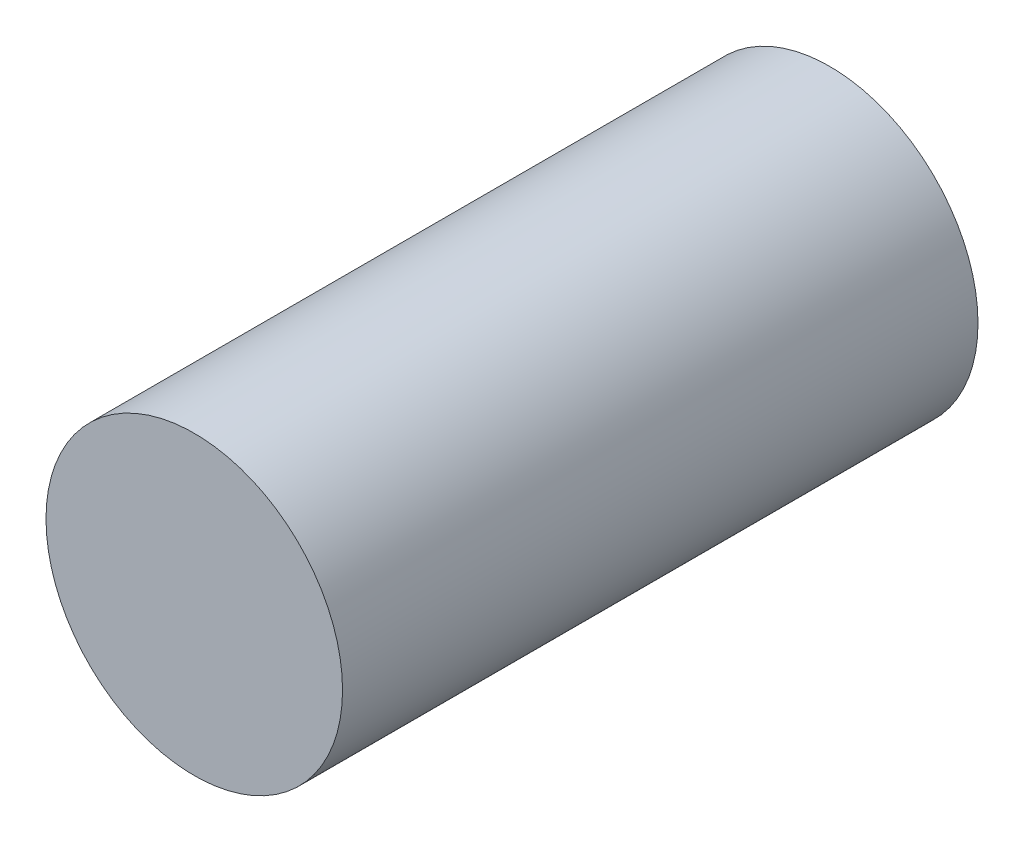
from build123d import *

# Parameters (mm, degrees)
SZKIC1_R                    = 1.05
DODANIE_WYCI_GNI_CIE1_DEPTH = 4.5


with BuildPart() as part:
    # Szkic1 → Dodanie-wyciągnięcie1 (new body)
    with BuildSketch(Plane.XY):
        Circle(SZKIC1_R)
    extrude(amount=DODANIE_WYCI_GNI_CIE1_DEPTH)


solid = part.part
